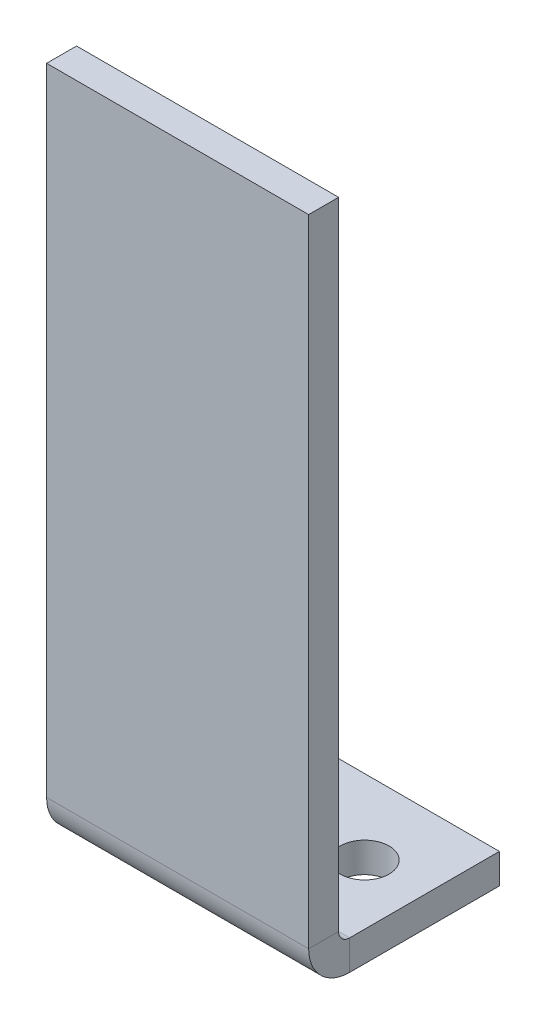
from build123d import *

# Parameters (mm, degrees)
SKETCH1_W                 = 17.5
SKETCH1_H                 = 55
BASE_FLANGE1_DEPTH        = 2
SKETCHED_START            = -23.286713287
SKETCHED_BEND3_DEPTH      = 17.5
SKETCHED_BEND3_2_DEPTH    = 17.5
F_4_CLEARANCE_HOLE1_D     = 3.2639
F_4_CLEARANCE_HOLE1_DEPTH = 2
F_4_CLEARANCE_HOLE1_TIP   = 0.980574487


# Read off the part's stored shape, not the designer's step: Sketched Bend3
# Sheet-metal steps are written as plain solids
with BuildPart() as part:
    # Sketch1 → Base-Flange1 (new body)
    with BuildSketch(Plane(origin=(0, 0, 0), x_dir=(1, 0, 0), z_dir=(0, 1, 0))):
        with Locations((-14.536713287, -6.17016317)):
            Rectangle(SKETCH1_W, SKETCH1_H)
    extrude(amount=-BASE_FLANGE1_DEPTH)

    # Sketched Bend3 outline → Sketched Bend3 (cut)
    with BuildSketch(Plane.YZ.offset(SKETCHED_START)):
        with BuildLine():
            ThreePointArc((-2, -11.32983683), (-1.443395312, -9.675569621), (0, -8.694234432))
            Line((0, -8.694234432), (0, 33.67016317))
            Line((0, 33.67016317), (-2, 33.67016317))
            Line((-2, 33.67016317), (-2, -11.32983683))
        make_face()
    extrude(amount=SKETCHED_BEND3_DEPTH, mode=Mode.SUBTRACT)

    # Sketched Bend3 2 outline → Sketched Bend3 2 (add)
    with BuildSketch(Plane.YZ.offset(SKETCHED_START)):
        with BuildLine():
            ThreePointArc((0, -11.32983683), (0.215745145, -10.808981975), (0.7366, -10.59323683))
            Line((0.7366, -10.59323683), (43.197250658, -10.59323683))
            Line((43.197250658, -10.59323683), (43.197250658, -8.59323683))
            Line((43.197250658, -8.59323683), (0.7366, -8.59323683))
            ThreePointArc((0.7366, -8.59323683), (0.364854094, -8.6186038), (0, -8.694234432))
            Line((0, -8.694234432), (0, -11.32983683))
        make_face()
    extrude(amount=SKETCHED_BEND3_2_DEPTH)

    # #4 Clearance Hole1
    with Locations(Plane.XZ.offset(2)):
        with Locations((-9.786713287, -16.32983683), (-19.286713287, -16.32983683)):
            Hole(F_4_CLEARANCE_HOLE1_D / 2, depth=F_4_CLEARANCE_HOLE1_DEPTH)
            with Locations((0, 0, -(F_4_CLEARANCE_HOLE1_DEPTH + F_4_CLEARANCE_HOLE1_TIP / 2))):  # 118° drill point
                Cone(0, F_4_CLEARANCE_HOLE1_D / 2, F_4_CLEARANCE_HOLE1_TIP, mode=Mode.SUBTRACT)


solid = part.part
